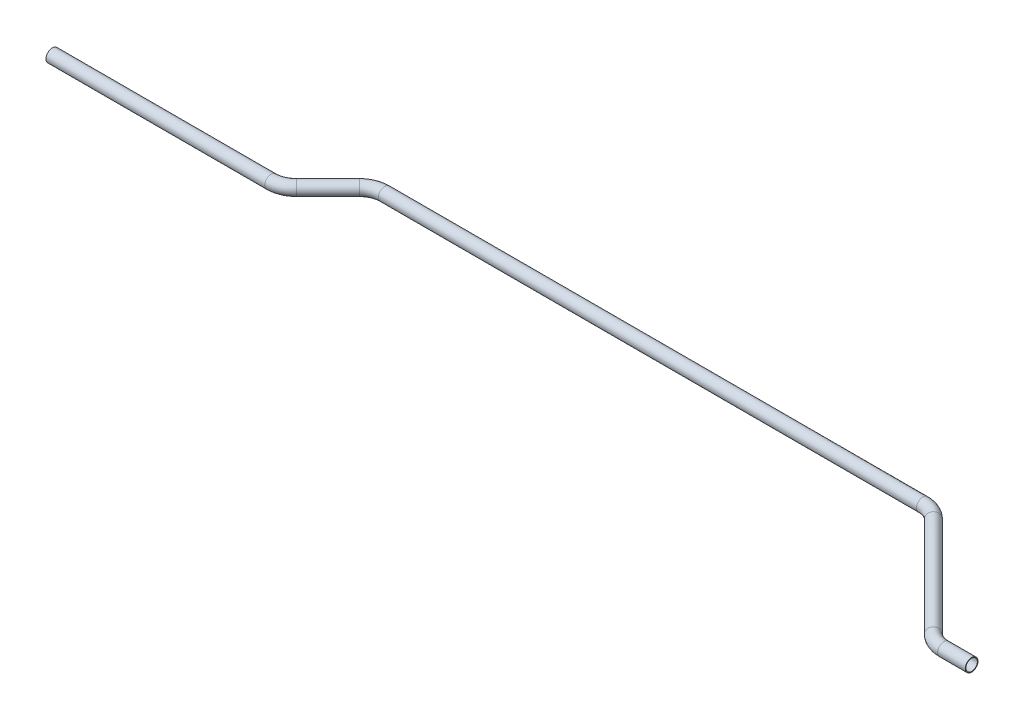
from build123d import *

# Parameters (mm, degrees)
SKETCH2_R   = 6.35
SKETCH2_R_2 = 5.715


with BuildPart() as part:
    # Sweep1: sweep along a path in Sketch1
    with BuildLine(Plane(origin=(0, 0, 0), x_dir=(1, 0, 0), z_dir=(0, 1, 0))) as sweep1_path:
        Line((0, 0), (218.078975516, 0))
        ThreePointArc((218.078975516, 0), (227.799134698, 1.933459874), (236.039487758, 7.439487758))
        Line((236.039487758, 7.439487758), (267.304371034, 38.704371034))
        ThreePointArc((267.304371034, 38.704371034), (275.544724094, 44.210398917), (285.264883276, 46.143858792))
        Line((285.264883276, 46.143858792), (821.755374307, 46.143858792))
        ThreePointArc((821.755374307, 46.143858792), (831.475533489, 44.210398917), (839.715886549, 38.704371034))
        Line((839.715886549, 38.704371034), (939.136911034, -60.716653451))
        ThreePointArc((939.136911034, -60.716653451), (947.377264094, -66.222681334), (957.097423276, -68.156141208))
        Line((957.097423276, -68.156141208), (984.676398792, -68.156141208))
    # Sketch2 → Sweep1 (sweep)
    with BuildSketch(Plane(origin=(0, 0, 0), x_dir=(0, 0, -1), z_dir=(1, 0, 0))):
        Circle(SKETCH2_R)
        Circle(SKETCH2_R_2, mode=Mode.SUBTRACT)
    sweep(path=sweep1_path.line)


solid = part.part
